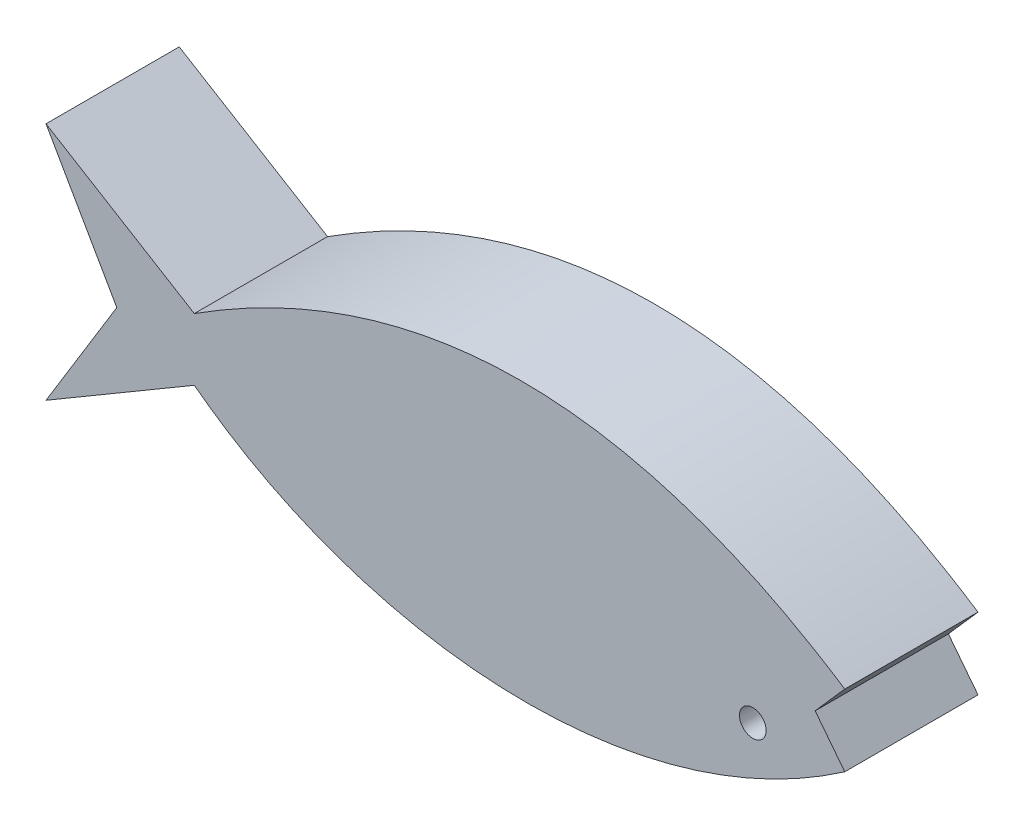
from build123d import *

# Parameters (mm, degrees)
SKETCH2_R           = 0.500109693
BOSS_EXTRUDE1_DEPTH = 5
BOSS_EXTRUDE2_DEPTH = 1


with BuildPart() as part:
    # Sketch2 → Boss-Extrude1 (new body)
    with BuildSketch(Plane(origin=(0, 0, 0), x_dir=(1, 0, 0), z_dir=(0, 0, -1))):
        with BuildLine():
            Line((29.97295835, 6.642737104), (28.862437793, 5.215722686))
            Line((28.862437793, 5.215722686), (29.97295835, 3.953817374))
            add(Edge.make_bspline(
                [(5.565346412, 3.953817374), (17.919076804, -3.939717318), (29.97295835, 3.953817374)],
                knots=[0, 0, 0, 1, 1, 1], degree=2))
            Line((5.565346412, 3.953817374), (0, 0.570103483))
            Line((0, 0.570103483), (2.65645961, 5.215722686))
            Line((2.65645961, 5.215722686), (0, 9.556126627))
            Line((0, 9.556126627), (5.565346412, 6.285726684))
            add(Edge.make_bspline(
                [(5.565346412, 6.285726684), (12.037313538, 11.217277608), (22.14175538, 12.07873787), (29.97295835, 6.642737104)],
                knots=[0, 0, 0, 0, 1, 1, 1, 1], degree=3))
        make_face()
        with Locations((26.5225963, 6.780666166)):
            Circle(SKETCH2_R, mode=Mode.SUBTRACT)
    extrude(amount=BOSS_EXTRUDE1_DEPTH)

    # Sketch4 → Boss-Extrude2 (add)
    with BuildSketch(Plane(origin=(0, 0, -5), x_dir=(1, 0, 0), z_dir=(0, 0, -1))):
        with BuildLine():
            Line((13.505925597, 9.20748465), (13.505925597, 1.423075144))
            Line((13.505925597, 1.423075144), (15.602241708, 1.423075144))
            Line((15.602241708, 1.423075144), (15.602241708, 5.315279897))
            add(Edge.make_bspline(
                [(15.602241708, 5.315279897), (16.55180304, 4.771600311), (17.819112763, 2.384653453), (18.244624835, 2.188263265)],
                knots=[0, 0, 0, 0, 1, 1, 1, 1], degree=3))
            add(Edge.make_bspline(
                [(18.244624835, 2.188263265), (18.779898358, 1.700394361), (19.463794025, 1.454827942), (20.295967672, 1.472164893)],
                knots=[0, 0, 0, 0, 1, 1, 1, 1], degree=3))
            add(Edge.make_bspline(
                [(20.295967672, 1.472164893), (21.947881004, 1.516976236), (22.928414953, 2.794274075), (23.074108957, 5.315279897)],
                knots=[0, 0, 0, 0, 1, 1, 1, 1], degree=3))
            add(Edge.make_bspline(
                [(20.002116591, 8.981680495), (21.931959476, 8.8416811), (22.979331343, 7.887920651), (23.074108957, 5.315279897)],
                knots=[0, 0, 0, 0, 1, 1, 1, 1], degree=3))
            Line((20.002116591, 8.981680495), (19.820939699, 6.416215707))
            add(Edge.make_bspline(
                [(21.167180554, 5.125606106), (21.180465057, 6.072198222), (20.440979853, 6.460923956), (19.820939699, 6.416215707)],
                knots=[0, 0, 0, 0, 1, 1, 1, 1], degree=3))
            add(Edge.make_bspline(
                [(20.221503107, 4.069560097), (20.691123944, 4.121889646), (21.155468987, 4.454455052), (21.167180554, 5.125606106)],
                knots=[0, 0, 0, 0, 1, 1, 1, 1], degree=3))
            add(Edge.make_bspline(
                [(18.680181158, 4.917707421), (19.007471293, 4.431114077), (19.807813447, 4.012463947), (20.221503107, 4.069560097)],
                knots=[0, 0, 0, 0, 1, 1, 1, 1], degree=3))
            add(Edge.make_bspline(
                [(13.505925597, 9.20748465), (15.7231737, 8.886132134), (17.035497046, 7.35232872), (18.680181158, 4.917707421)],
                knots=[0, 0, 0, 0, 1, 1, 1, 1], degree=3))
        make_face()
    extrude(amount=BOSS_EXTRUDE2_DEPTH)


solid = part.part
